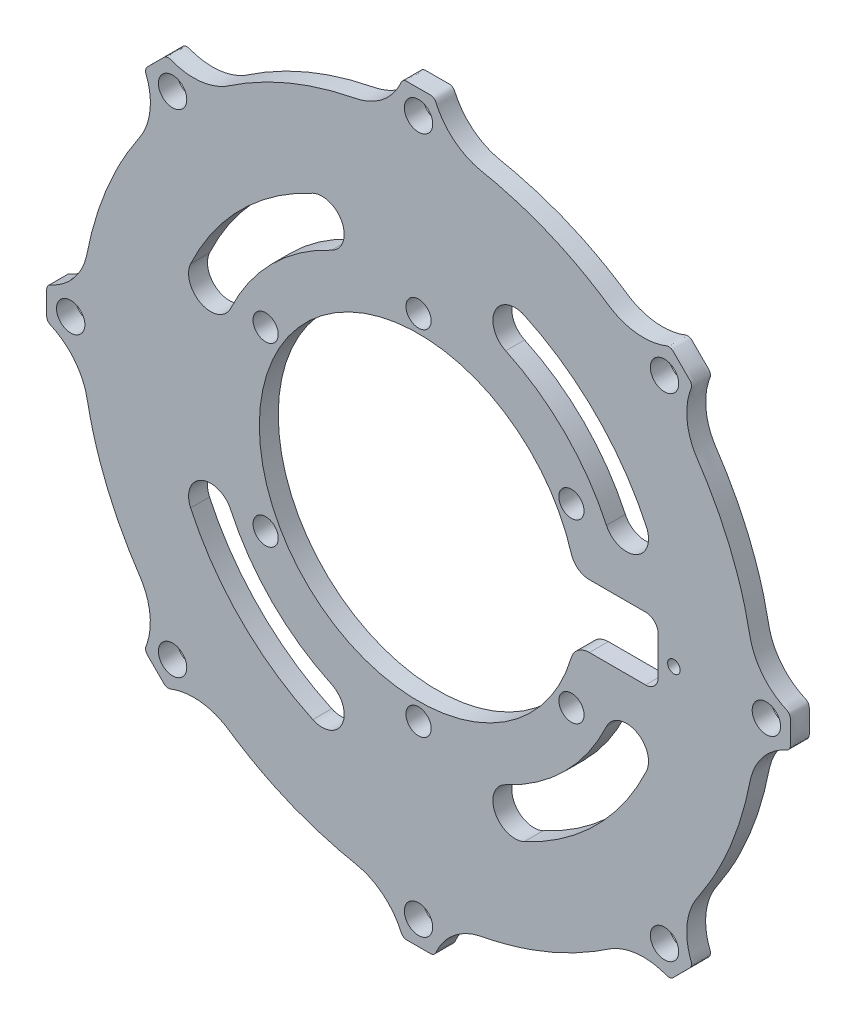
from build123d import *

# Parameters (mm, degrees)
SKETCH1_R                 = 1
BOSS_EXTRUDE1_DEPTH       = 3
F_4_0MM_DOWEL_HOLE1_D     = 4
F_4_0MM_DOWEL_HOLE1_DEPTH = 4
F_4_0MM_DOWEL_HOLE1_TIP   = 1.201721238
M4_CLEARANCE_HOLE1_D      = 4.5
M4_CLEARANCE_HOLE1_DEPTH  = 4
M4_CLEARANCE_HOLE1_TIP    = 1.351936393


with BuildPart() as part:
    # Sketch1 → Boss-Extrude1 (new body)
    with BuildSketch(Plane.XY):
        with BuildLine():
            add(Edge.make_bspline(
                [(-2.78417409, 58.319718749), (-2.791517372, 58.303124149), (-2.825354451, 58.225735415), (-2.86043616, 58.149718786), (-2.888569338, 58.090305414)],
                knots=[0.999328518, 0.999328518, 0.999328518, 0.999328518, 0.99947273, 1, 1, 1, 1], degree=3, weights=[1, 1, 1, 1, 1]))
            add(Edge.make_bspline(
                [(-2.888569338, 58.090305414), (-3.904277799, 55.9452699), (-5.591838924, 54.27644442), (-7.748079959, 53.284746062), (-8.235225684, 53.060698004), (-9.245557382, 52.690963884), (-10.84227328, 52.398071486), (-11.889156148, 52.164983222), (-12.410727624, 52.040597997), (-17.936005436, 50.722920633), (-23.183850069, 48.549192213), (-28.022550078, 45.573969403), (-28.479310442, 45.293116312), (-29.384386709, 44.717676629), (-30.720541549, 43.79573419), (-31.696395448, 43.342763299), (-32.199285394, 43.156725154), (-34.52028494, 42.298099023), (-36.994919588, 42.319571853), (-39.300669877, 43.218345087), (-39.301071956, 43.218501816), (-39.301876093, 43.218815326), (-39.303082259, 43.219285695), (-39.303886295, 43.219599465), (-39.304288312, 43.21975635), (-39.304689349, 43.219912852), (-39.305491422, 43.220225856), (-39.306694532, 43.220695362), (-39.307496605, 43.221008367), (-39.307897642, 43.221164869), (-39.310303861, 43.222103881), (-39.31271008, 43.223042894), (-39.3151163, 43.223981906), (-39.315517337, 43.224138408), (-39.31631941, 43.224451412), (-39.317522519, 43.224920919), (-39.318324593, 43.225233923), (-39.318725629, 43.225390425), (-39.319128068, 43.225547474), (-39.319932946, 43.225861573), (-39.321141382, 43.226329852), (-39.321947274, 43.226641342), (-39.32235032, 43.226796825), (-39.599832465, 43.333841276), (-39.896638588, 43.314841774), (-40.158207362, 43.173290965), (-40.186385644, 43.158041979), (-40.241276486, 43.124835529), (-40.32140827, 43.068886213), (-40.366719354, 43.023575129), (-40.389374896, 43.000919586), (-40.412030438, 42.978264044), (-40.457341522, 42.93295296), (-40.525308148, 42.864986334), (-40.570619233, 42.81967525), (-40.593274775, 42.797019708), (-41.327856419, 42.062438063), (-42.062438063, 41.327856419), (-42.797019708, 40.593274775), (-42.81967525, 40.570619233), (-42.864986334, 40.525308148), (-42.93295296, 40.457341522), (-42.978264044, 40.412030438), (-43.000919586, 40.389374896), (-43.023575129, 40.366719354), (-43.068886213, 40.32140827), (-43.124835529, 40.241276486), (-43.158041979, 40.186385644), (-43.173290965, 40.158207362), (-43.314841774, 39.896638588), (-43.333841276, 39.599832465), (-43.226796825, 39.32235032), (-43.226641342, 39.321947274), (-43.226329852, 39.321141382), (-43.225861573, 39.319932946), (-43.225547474, 39.319128068), (-43.225390425, 39.318725629), (-43.225233923, 39.318324593), (-43.224920919, 39.317522519), (-43.224451412, 39.31631941), (-43.224138408, 39.315517337), (-43.223981906, 39.3151163), (-43.223042894, 39.31271008), (-43.222103881, 39.310303861), (-43.221164869, 39.307897642), (-43.221008367, 39.307496605), (-43.220695362, 39.306694532), (-43.220225856, 39.305491422), (-43.219912852, 39.304689349), (-43.21975635, 39.304288312), (-43.219599465, 39.303886294), (-43.219285695, 39.303082259), (-43.218815326, 39.301876093), (-43.218501816, 39.301071956), (-43.218345087, 39.300669877), (-42.319571853, 36.994919588), (-42.298099023, 34.52028494), (-43.156725154, 32.199285394), (-43.342763299, 31.696395448), (-43.79573419, 30.720541549), (-44.717676629, 29.384386709), (-45.293116312, 28.479310442), (-45.573969403, 28.022550078), (-48.549192213, 23.183850069), (-50.722920633, 17.936005436), (-52.040597997, 12.410727624), (-52.164983222, 11.889156148), (-52.398071486, 10.84227328), (-52.690963884, 9.245557382), (-53.060698004, 8.235225684), (-53.284746062, 7.748079959), (-54.31880022, 5.499745081), (-56.083814744, 3.765097724), (-58.349755058, 2.770214708), (-58.350150195, 2.770041219), (-58.350940491, 2.769694293), (-58.35212598, 2.769174006), (-58.352916388, 2.768827336), (-58.353311592, 2.768654001), (-58.353705831, 2.768481089), (-58.35449431, 2.768135265), (-58.355677028, 2.767616529), (-58.356465507, 2.767270705), (-58.356859746, 2.767097793), (-58.359225182, 2.766060321), (-58.361590618, 2.765022849), (-58.363956055, 2.763985377), (-58.364350294, 2.763812465), (-58.365138773, 2.763466641), (-58.366321491, 2.762947905), (-58.367109969, 2.762602081), (-58.367504209, 2.762429169), (-58.367899827, 2.762255652), (-58.368691063, 2.761908619), (-58.36987668, 2.761385249), (-58.370666787, 2.761035654), (-58.371061728, 2.7608606), (-58.642963091, 2.640342951), (-58.839402036, 2.417034653), (-58.924267553, 2.131986062), (-58.933409946, 2.101278346), (-58.948743127, 2.038984153), (-58.965842714, 1.942760285), (-58.965842714, 1.878680735), (-58.965842714, 1.84664096), (-58.965842714, 1.814601185), (-58.965842714, 1.750521635), (-58.965842714, 1.654402311), (-58.965842714, 1.590322761), (-58.965842714, 1.558282986), (-58.965842714, 0.519427662), (-58.965842714, -0.519427662), (-58.965842714, -1.558282986), (-58.965842714, -1.590322761), (-58.965842714, -1.654402311), (-58.965842714, -1.750521635), (-58.965842714, -1.814601185), (-58.965842714, -1.84664096), (-58.965842714, -1.878680735), (-58.965842714, -1.942760285), (-58.948743127, -2.038984153), (-58.933409946, -2.101278346), (-58.924267553, -2.131986062), (-58.839402036, -2.417034653), (-58.642963091, -2.640342951), (-58.371061728, -2.7608606), (-58.370666787, -2.761035654), (-58.36987668, -2.761385249), (-58.368691063, -2.761908619), (-58.367899827, -2.762255652), (-58.367504209, -2.762429169), (-58.367109969, -2.762602081), (-58.366321491, -2.762947905), (-58.365138773, -2.763466641), (-58.364350294, -2.763812465), (-58.363956055, -2.763985377), (-58.361590618, -2.765022849), (-58.359225182, -2.766060321), (-58.356859746, -2.767097793), (-58.356465507, -2.767270705), (-58.355677028, -2.767616529), (-58.35449431, -2.768135265), (-58.353705831, -2.768481089), (-58.353311592, -2.768654001), (-58.352916388, -2.768827336), (-58.35212598, -2.769174006), (-58.350940491, -2.769694293), (-58.350150195, -2.770041219), (-58.349755058, -2.770214708), (-56.083814744, -3.765097724), (-54.31880022, -5.499745081), (-53.284746062, -7.748079959), (-53.060698004, -8.235225684), (-52.690963884, -9.245557382), (-52.398071486, -10.84227328), (-52.164983222, -11.889156148), (-52.040597997, -12.410727624), (-50.722920633, -17.936005436), (-48.549192213, -23.183850069), (-45.573969403, -28.022550078), (-45.293116312, -28.479310442), (-44.717676629, -29.384386709), (-43.79573419, -30.720541549), (-43.342763299, -31.696395448), (-43.156725154, -32.199285394), (-42.298099023, -34.52028494), (-42.319571853, -36.994919588), (-43.218345087, -39.300669877), (-43.218501816, -39.301071956), (-43.218815326, -39.301876093), (-43.219285695, -39.303082259), (-43.219599465, -39.303886294), (-43.21975635, -39.304288312), (-43.219912852, -39.304689349), (-43.220225856, -39.305491422), (-43.220695362, -39.306694532), (-43.221008367, -39.307496605), (-43.221164869, -39.307897642), (-43.222103881, -39.310303861), (-43.223042894, -39.31271008), (-43.223981906, -39.3151163), (-43.224138408, -39.315517337), (-43.224451412, -39.31631941), (-43.224920919, -39.317522519), (-43.225233923, -39.318324593), (-43.225390425, -39.318725629), (-43.225547474, -39.319128068), (-43.225861573, -39.319932946), (-43.226329852, -39.321141382), (-43.226641342, -39.321947274), (-43.226796825, -39.32235032), (-43.333841276, -39.599832465), (-43.314841774, -39.896638588), (-43.173290965, -40.158207362), (-43.158041979, -40.186385644), (-43.124835529, -40.241276486), (-43.068886213, -40.32140827), (-43.023575129, -40.366719354), (-43.000919586, -40.389374896), (-42.978264044, -40.412030438), (-42.93295296, -40.457341522), (-42.864986334, -40.525308148), (-42.81967525, -40.570619233), (-42.797019708, -40.593274775), (-42.062438063, -41.327856419), (-41.327856419, -42.062438063), (-40.593274775, -42.797019708), (-40.570619233, -42.81967525), (-40.525308148, -42.864986334), (-40.457341522, -42.93295296), (-40.412030438, -42.978264044), (-40.389374896, -43.000919586), (-40.366719354, -43.023575129), (-40.32140827, -43.068886213), (-40.241276486, -43.124835529), (-40.186385644, -43.158041979), (-40.158207362, -43.173290965), (-39.896638588, -43.314841774), (-39.599832465, -43.333841276), (-39.32235032, -43.226796825), (-39.321947274, -43.226641342), (-39.321141382, -43.226329852), (-39.319932946, -43.225861573), (-39.319128068, -43.225547474), (-39.318725629, -43.225390425), (-39.318324593, -43.225233923), (-39.317522519, -43.224920919), (-39.31631941, -43.224451412), (-39.315517337, -43.224138408), (-39.3151163, -43.223981906), (-39.31271008, -43.223042894), (-39.310303861, -43.222103881), (-39.307897642, -43.221164869), (-39.307496605, -43.221008367), (-39.306694532, -43.220695362), (-39.305491422, -43.220225856), (-39.304689349, -43.219912852), (-39.304288312, -43.21975635), (-39.303886294, -43.219599465), (-39.303082259, -43.219285695), (-39.301876093, -43.218815326), (-39.301071956, -43.218501816), (-39.300669877, -43.218345087), (-36.994919588, -42.319571853), (-34.52028494, -42.298099023), (-32.199285394, -43.156725154), (-31.696395448, -43.342763299), (-30.720541549, -43.79573419), (-29.384386709, -44.717676629), (-28.479310442, -45.293116312), (-28.022550078, -45.573969403), (-23.183850069, -48.549192213), (-17.936005436, -50.722920633), (-12.410727624, -52.040597997), (-11.889156148, -52.164983222), (-10.84227328, -52.398071486), (-9.245557382, -52.690963884), (-8.235225684, -53.060698004), (-7.748079959, -53.284746062), (-5.499745081, -54.31880022), (-3.765097724, -56.083814744), (-2.770214708, -58.349755058), (-2.770041219, -58.350150195), (-2.769694293, -58.350940491), (-2.769174006, -58.35212598), (-2.768827336, -58.352916388), (-2.768654001, -58.353311592), (-2.768481089, -58.353705831), (-2.768135265, -58.35449431), (-2.767616529, -58.355677028), (-2.767270705, -58.356465507), (-2.767097793, -58.356859746), (-2.766060321, -58.359225182), (-2.765022849, -58.361590618), (-2.763985377, -58.363956055), (-2.763812465, -58.364350294), (-2.763466641, -58.365138773), (-2.762947905, -58.366321491), (-2.762602081, -58.367109969), (-2.762429169, -58.367504209), (-2.762255652, -58.367899827), (-2.761908619, -58.368691063), (-2.761385249, -58.36987668), (-2.761035654, -58.370666787), (-2.7608606, -58.371061728), (-2.640342951, -58.642963091), (-2.417034653, -58.839402036), (-2.131986062, -58.924267553), (-2.101278346, -58.933409946), (-2.038984153, -58.948743127), (-1.942760285, -58.965842714), (-1.878680735, -58.965842714), (-1.84664096, -58.965842714), (-1.814601185, -58.965842714), (-1.750521635, -58.965842714), (-1.654402311, -58.965842714), (-1.590322761, -58.965842714), (-1.558282986, -58.965842714), (-0.519427662, -58.965842714), (0.519427662, -58.965842714), (1.558282986, -58.965842714), (1.590322761, -58.965842714), (1.654402311, -58.965842714), (1.750521635, -58.965842714), (1.814601185, -58.965842714), (1.84664096, -58.965842714), (1.878680735, -58.965842714), (1.942760285, -58.965842714), (2.038984153, -58.948743127), (2.101278346, -58.933409946), (2.131986062, -58.924267553), (2.417034653, -58.839402036), (2.640342951, -58.642963091), (2.7608606, -58.371061728), (2.761035654, -58.370666787), (2.761385249, -58.36987668), (2.761908619, -58.368691063), (2.762255652, -58.367899827), (2.762429169, -58.367504209), (2.762602081, -58.367109969), (2.762947905, -58.366321491), (2.763466641, -58.365138773), (2.763812465, -58.364350294), (2.763985377, -58.363956055), (2.765022849, -58.361590618), (2.766060321, -58.359225182), (2.767097793, -58.356859746), (2.767270705, -58.356465507), (2.767616529, -58.355677028), (2.768135265, -58.35449431), (2.768481089, -58.353705831), (2.768654001, -58.353311592), (2.768827336, -58.352916388), (2.769174006, -58.35212598), (2.769694293, -58.350940491), (2.770041219, -58.350150195), (2.770214708, -58.349755058), (3.765097724, -56.083814744), (5.499745081, -54.31880022), (7.748079959, -53.284746062), (8.235225684, -53.060698004), (9.245557382, -52.690963884), (10.84227328, -52.398071486), (11.889156148, -52.164983222), (12.410727624, -52.040597997), (17.936005436, -50.722920633), (23.183850069, -48.549192213), (28.022550078, -45.573969403), (28.479310442, -45.293116312), (29.384386709, -44.717676629), (30.720541549, -43.79573419), (31.696395448, -43.342763299), (32.199285394, -43.156725154), (34.52028494, -42.298099023), (36.994919588, -42.319571853), (39.300669877, -43.218345087), (39.301071956, -43.218501816), (39.301876093, -43.218815326), (39.303082259, -43.219285695), (39.303886294, -43.219599465), (39.304288312, -43.21975635), (39.304689349, -43.219912852), (39.305491422, -43.220225856), (39.306694532, -43.220695362), (39.307496605, -43.221008367), (39.307897642, -43.221164869), (39.310303861, -43.222103881), (39.31271008, -43.223042894), (39.3151163, -43.223981906), (39.315517337, -43.224138408), (39.31631941, -43.224451412), (39.317522519, -43.224920919), (39.318324593, -43.225233923), (39.318725629, -43.225390425), (39.319128068, -43.225547474), (39.319932946, -43.225861573), (39.321141382, -43.226329852), (39.321947274, -43.226641342), (39.32235032, -43.226796825), (39.599832465, -43.333841276), (39.896638588, -43.314841774), (40.158207362, -43.173290965), (40.186385644, -43.158041979), (40.241276486, -43.124835529), (40.32140827, -43.068886213), (40.366719354, -43.023575129), (40.389374896, -43.000919586), (40.412030438, -42.978264044), (40.457341522, -42.93295296), (40.525308148, -42.864986334), (40.570619233, -42.81967525), (40.593274775, -42.797019708), (41.327856419, -42.062438063), (42.062438063, -41.327856419), (42.797019708, -40.593274775), (42.81967525, -40.570619233), (42.864986334, -40.525308148), (42.93295296, -40.457341522), (42.978264044, -40.412030438), (43.000919586, -40.389374896), (43.023575129, -40.366719354), (43.068886213, -40.32140827), (43.124835529, -40.241276486), (43.158041979, -40.186385644), (43.173290965, -40.158207362), (43.314841774, -39.896638588), (43.333841276, -39.599832465), (43.226796825, -39.32235032), (43.226641342, -39.321947274), (43.226329852, -39.321141382), (43.225861573, -39.319932946), (43.225547474, -39.319128068), (43.225390425, -39.318725629), (43.225233923, -39.318324593), (43.224920919, -39.317522519), (43.224451412, -39.31631941), (43.224138408, -39.315517337), (43.223981906, -39.3151163), (43.223042894, -39.31271008), (43.222103881, -39.310303861), (43.221164869, -39.307897642), (43.221008367, -39.307496605), (43.220695362, -39.306694532), (43.220225856, -39.305491422), (43.219912852, -39.304689349), (43.21975635, -39.304288312), (43.219599465, -39.303886294), (43.219285695, -39.303082259), (43.218815326, -39.301876093), (43.218501816, -39.301071956), (43.218345087, -39.300669877), (42.319571853, -36.994919588), (42.298099023, -34.52028494), (43.156725154, -32.199285394), (43.342763299, -31.696395448), (43.79573419, -30.720541549), (44.717676629, -29.384386709), (45.293116312, -28.479310442), (45.573969403, -28.022550078), (48.549192213, -23.183850069), (50.722920633, -17.936005436), (52.040597997, -12.410727624), (52.164983222, -11.889156148), (52.398071486, -10.84227328), (52.690963884, -9.245557382), (53.060698004, -8.235225684), (53.284746062, -7.748079959), (54.31880022, -5.499745081), (56.083814744, -3.765097724), (58.349755058, -2.770214708), (58.350150195, -2.770041219), (58.350940491, -2.769694293), (58.35212598, -2.769174006), (58.352916388, -2.768827336), (58.353311592, -2.768654001), (58.353705831, -2.768481089), (58.35449431, -2.768135265), (58.355677028, -2.767616529), (58.356465507, -2.767270705), (58.356859746, -2.767097793), (58.359225182, -2.766060321), (58.361590618, -2.765022849), (58.363956055, -2.763985377), (58.364350294, -2.763812465), (58.365138773, -2.763466641), (58.366321491, -2.762947905), (58.367109969, -2.762602081), (58.367504209, -2.762429169), (58.367899827, -2.762255652), (58.368691063, -2.761908619), (58.36987668, -2.761385249), (58.370666787, -2.761035654), (58.371061728, -2.7608606), (58.642963091, -2.640342951), (58.839402036, -2.417034653), (58.924267553, -2.131986062), (58.933409946, -2.101278346), (58.948743127, -2.038984153), (58.965842714, -1.942760285), (58.965842714, -1.878680735), (58.965842714, -1.84664096), (58.965842714, -1.814601185), (58.965842714, -1.750521635), (58.965842714, -1.654402311), (58.965842714, -1.590322761), (58.965842714, -1.558282986), (58.965842714, -0.519427662), (58.965842714, 0.519427662), (58.965842714, 1.558282986), (58.965842714, 1.590322761), (58.965842714, 1.654402311), (58.965842714, 1.750521635), (58.965842714, 1.814601185), (58.965842714, 1.84664096), (58.965842714, 1.878680735), (58.965842714, 1.942760285), (58.948743127, 2.038984153), (58.933409946, 2.101278346), (58.924267553, 2.131986062), (58.839402036, 2.417034653), (58.642963091, 2.640342951), (58.371061728, 2.7608606), (58.370666787, 2.761035654), (58.36987668, 2.761385249), (58.368691063, 2.761908619), (58.367899827, 2.762255652), (58.367504209, 2.762429169), (58.367109969, 2.762602081), (58.366321491, 2.762947905), (58.365138773, 2.763466641), (58.364350294, 2.763812465), (58.363956055, 2.763985377), (58.361590618, 2.765022849), (58.359225182, 2.766060321), (58.356859746, 2.767097793), (58.356465507, 2.767270705), (58.355677028, 2.767616529), (58.35449431, 2.768135265), (58.353705831, 2.768481089), (58.353311592, 2.768654001), (58.352916388, 2.768827336), (58.35212598, 2.769174006), (58.350940491, 2.769694293), (58.350150195, 2.770041219), (58.349755058, 2.770214708), (56.083814744, 3.765097724), (54.31880022, 5.499745081), (53.284746062, 7.748079959), (53.060698004, 8.235225684), (52.690963884, 9.245557382), (52.398071486, 10.84227328), (52.164983222, 11.889156148), (52.040597997, 12.410727624), (50.722920633, 17.936005436), (48.549192213, 23.183850069), (45.573969403, 28.022550078), (45.293116312, 28.479310442), (44.717676629, 29.384386709), (43.79573419, 30.720541549), (43.342763299, 31.696395448), (43.156725154, 32.199285394), (42.298099023, 34.52028494), (42.319571853, 36.994919588), (43.218345087, 39.300669877), (43.218501816, 39.301071956), (43.218815326, 39.301876093), (43.219285695, 39.303082259), (43.219599465, 39.303886294), (43.21975635, 39.304288312), (43.219912852, 39.304689349), (43.220225856, 39.305491422), (43.220695362, 39.306694532), (43.221008367, 39.307496605), (43.221164869, 39.307897642), (43.222103881, 39.310303861), (43.223042894, 39.31271008), (43.223981906, 39.3151163), (43.224138408, 39.315517337), (43.224451412, 39.31631941), (43.224920919, 39.317522519), (43.225233923, 39.318324593), (43.225390425, 39.318725629), (43.225547474, 39.319128068), (43.225861573, 39.319932946), (43.226329852, 39.321141382), (43.226641342, 39.321947274), (43.226796825, 39.32235032), (43.333841276, 39.599832465), (43.314841774, 39.896638588), (43.173290965, 40.158207362), (43.158041979, 40.186385644), (43.124835529, 40.241276486), (43.068886213, 40.32140827), (43.023575129, 40.366719354), (43.000919586, 40.389374896), (42.978264044, 40.412030438), (42.93295296, 40.457341522), (42.864986334, 40.525308148), (42.81967525, 40.570619233), (42.797019708, 40.593274775), (42.062438063, 41.327856419), (41.327856419, 42.062438063), (40.593274775, 42.797019708), (40.570619233, 42.81967525), (40.525308148, 42.864986334), (40.457341522, 42.93295296), (40.412030438, 42.978264044), (40.389374896, 43.000919586), (40.366719354, 43.023575129), (40.32140827, 43.068886213), (40.241276486, 43.124835529), (40.186385644, 43.158041979), (40.158207362, 43.173290965), (39.896638588, 43.314841774), (39.599832465, 43.333841276), (39.32235032, 43.226796825), (39.321947274, 43.226641342), (39.321141382, 43.226329852), (39.319932946, 43.225861573), (39.319128068, 43.225547474), (39.318725629, 43.225390425), (39.318324593, 43.225233923), (39.317522519, 43.224920919), (39.31631941, 43.224451412), (39.315517337, 43.224138408), (39.3151163, 43.223981906), (39.31271008, 43.223042894), (39.310303861, 43.222103881), (39.307897642, 43.221164869), (39.307496605, 43.221008367), (39.306694532, 43.220695362), (39.305491422, 43.220225856), (39.304689349, 43.219912852), (39.304288312, 43.21975635), (39.303886294, 43.219599465), (39.303082259, 43.219285695), (39.301876093, 43.218815326), (39.301071956, 43.218501816), (39.300669877, 43.218345087), (36.994919588, 42.319571853), (34.52028494, 42.298099023), (32.199285394, 43.156725154), (31.696395448, 43.342763299), (30.720541549, 43.79573419), (29.384386709, 44.717676629), (28.479310442, 45.293116312), (28.022550078, 45.573969403), (23.183850069, 48.549192213), (17.936005436, 50.722920633), (12.410727624, 52.040597997), (11.889156148, 52.164983222), (10.84227328, 52.398071486), (9.245557382, 52.690963884), (8.235225684, 53.060698004), (7.748079959, 53.284746062), (5.591838924, 54.27644442), (3.904277799, 55.9452699), (2.888569338, 58.090305414), (2.86043616, 58.149718786), (2.805341513, 58.269100351), (2.727304111, 58.453248868), (2.652227716, 58.561956296), (2.609742987, 58.612120747), (2.483296792, 58.761423899), (2.319504695, 58.868438946), (2.131986062, 58.924267553), (2.101278346, 58.933409946), (2.038984153, 58.948743127), (1.942760285, 58.965842714), (1.878680735, 58.965842714), (1.84664096, 58.965842714), (1.814601185, 58.965842714), (1.750521635, 58.965842714), (1.654402311, 58.965842714), (1.590322761, 58.965842714), (1.558282986, 58.965842714), (0.519427662, 58.965842714), (-0.519427662, 58.965842714), (-1.558282986, 58.965842714), (-1.590322761, 58.965842714), (-1.654402311, 58.965842714), (-1.750521635, 58.965842714), (-1.814601185, 58.965842714), (-1.84664096, 58.965842714), (-1.878680735, 58.965842714), (-1.942760285, 58.965842714), (-2.038984153, 58.948743127), (-2.101278346, 58.933409946), (-2.131986062, 58.924267553), (-2.319504695, 58.868438946), (-2.483296792, 58.761423899), (-2.609742987, 58.612120747), (-2.652227716, 58.561956296), (-2.717037152, 58.468114989), (-2.764668765, 58.363797551), (-2.78417409, 58.319718749)],
                knots=[0, 0, 0, 0, 0.018272392, 0.018272392, 0.018272392, 0.022573152, 0.026873912, 0.031174673, 0.031174673, 0.031174673, 0.076353702, 0.076353702, 0.076353702, 0.080654462, 0.084955222, 0.089255982, 0.089255982, 0.089255982, 0.108243055, 0.108243055, 0.108243055, 0.108246516, 0.108249978, 0.108253439, 0.108253439, 0.108253439, 0.108256892, 0.108260345, 0.108263798, 0.108263798, 0.108263798, 0.108284515, 0.108284515, 0.108284515, 0.108287968, 0.108291421, 0.108294874, 0.108294874, 0.108294874, 0.108298339, 0.108301804, 0.108305269, 0.108305269, 0.108305269, 0.110544601, 0.110544601, 0.110544601, 0.110801587, 0.111058573, 0.111315559, 0.111315559, 0.111315559, 0.111572545, 0.111829531, 0.112086517, 0.112086517, 0.112086517, 0.12041901, 0.12041901, 0.12041901, 0.120675996, 0.120932982, 0.121189968, 0.121189968, 0.121189968, 0.121446954, 0.12170394, 0.121960926, 0.121960926, 0.121960926, 0.124200258, 0.124200258, 0.124200258, 0.124203723, 0.124207188, 0.124210653, 0.124210653, 0.124210653, 0.124214106, 0.124217559, 0.124221012, 0.124221012, 0.124221012, 0.124241729, 0.124241729, 0.124241729, 0.124245182, 0.124248635, 0.124252088, 0.124252088, 0.124252088, 0.12425555, 0.124259011, 0.124262472, 0.124262472, 0.124262472, 0.143249545, 0.143249545, 0.143249545, 0.147550305, 0.151851065, 0.156151825, 0.156151825, 0.156151825, 0.201330854, 0.201330854, 0.201330854, 0.205631615, 0.209932375, 0.214233135, 0.214233135, 0.214233135, 0.233220208, 0.233220208, 0.233220208, 0.233223669, 0.23322713, 0.233230592, 0.233230592, 0.233230592, 0.233234045, 0.233237497, 0.23324095, 0.23324095, 0.23324095, 0.233261668, 0.233261668, 0.233261668, 0.233265121, 0.233268574, 0.233272027, 0.233272027, 0.233272027, 0.233275492, 0.233278957, 0.233282421, 0.233282421, 0.233282421, 0.235521754, 0.235521754, 0.235521754, 0.23577874, 0.236035726, 0.236292712, 0.236292712, 0.236292712, 0.236549698, 0.236806684, 0.23706367, 0.23706367, 0.23706367, 0.245396163, 0.245396163, 0.245396163, 0.245653149, 0.245910135, 0.246167121, 0.246167121, 0.246167121, 0.246424107, 0.246681092, 0.246938078, 0.246938078, 0.246938078, 0.249177411, 0.249177411, 0.249177411, 0.249180876, 0.249184341, 0.249187806, 0.249187806, 0.249187806, 0.249191259, 0.249194712, 0.249198165, 0.249198165, 0.249198165, 0.249218882, 0.249218882, 0.249218882, 0.249222335, 0.249225788, 0.249229241, 0.249229241, 0.249229241, 0.249232702, 0.249236164, 0.249239625, 0.249239625, 0.249239625, 0.268226698, 0.268226698, 0.268226698, 0.272527458, 0.276828218, 0.281128978, 0.281128978, 0.281128978, 0.326308007, 0.326308007, 0.326308007, 0.330608767, 0.334909528, 0.339210288, 0.339210288, 0.339210288, 0.35819736, 0.35819736, 0.35819736, 0.358200822, 0.358204283, 0.358207744, 0.358207744, 0.358207744, 0.358211197, 0.35821465, 0.358218103, 0.358218103, 0.358218103, 0.358238821, 0.358238821, 0.358238821, 0.358242273, 0.358245726, 0.358249179, 0.358249179, 0.358249179, 0.358252644, 0.358256109, 0.358259574, 0.358259574, 0.358259574, 0.360498907, 0.360498907, 0.360498907, 0.360755893, 0.361012879, 0.361269865, 0.361269865, 0.361269865, 0.361526851, 0.361783837, 0.362040823, 0.362040823, 0.362040823, 0.370373316, 0.370373316, 0.370373316, 0.370630301, 0.370887287, 0.371144273, 0.371144273, 0.371144273, 0.371401259, 0.371658245, 0.371915231, 0.371915231, 0.371915231, 0.374154564, 0.374154564, 0.374154564, 0.374158029, 0.374161494, 0.374164959, 0.374164959, 0.374164959, 0.374168412, 0.374171865, 0.374175318, 0.374175318, 0.374175318, 0.374196035, 0.374196035, 0.374196035, 0.374199488, 0.374202941, 0.374206394, 0.374206394, 0.374206394, 0.374209855, 0.374213316, 0.374216778, 0.374216778, 0.374216778, 0.39320385, 0.39320385, 0.39320385, 0.397504611, 0.401805371, 0.406106131, 0.406106131, 0.406106131, 0.45128516, 0.45128516, 0.45128516, 0.45558592, 0.45988668, 0.46418744, 0.46418744, 0.46418744, 0.483174513, 0.483174513, 0.483174513, 0.483177974, 0.483181436, 0.483184897, 0.483184897, 0.483184897, 0.48318835, 0.483191803, 0.483195256, 0.483195256, 0.483195256, 0.483215973, 0.483215973, 0.483215973, 0.483219426, 0.483222879, 0.483226332, 0.483226332, 0.483226332, 0.483229797, 0.483233262, 0.483236727, 0.483236727, 0.483236727, 0.48547606, 0.48547606, 0.48547606, 0.485733046, 0.485990032, 0.486247017, 0.486247017, 0.486247017, 0.486504003, 0.486760989, 0.487017975, 0.487017975, 0.487017975, 0.495350468, 0.495350468, 0.495350468, 0.495607454, 0.49586444, 0.496121426, 0.496121426, 0.496121426, 0.496378412, 0.496635398, 0.496892384, 0.496892384, 0.496892384, 0.499131717, 0.499131717, 0.499131717, 0.499135182, 0.499138647, 0.499142112, 0.499142112, 0.499142112, 0.499145564, 0.499149017, 0.49915247, 0.49915247, 0.49915247, 0.499173188, 0.499173188, 0.499173188, 0.499176641, 0.499180094, 0.499183546, 0.499183546, 0.499183546, 0.499187008, 0.499190469, 0.49919393, 0.49919393, 0.49919393, 0.518181003, 0.518181003, 0.518181003, 0.522481763, 0.526782523, 0.531083284, 0.531083284, 0.531083284, 0.576262313, 0.576262313, 0.576262313, 0.580563073, 0.584863833, 0.589164593, 0.589164593, 0.589164593, 0.608151666, 0.608151666, 0.608151666, 0.608155127, 0.608158589, 0.60816205, 0.60816205, 0.60816205, 0.608165503, 0.608168956, 0.608172409, 0.608172409, 0.608172409, 0.608193126, 0.608193126, 0.608193126, 0.608196579, 0.608200032, 0.608203485, 0.608203485, 0.608203485, 0.60820695, 0.608210415, 0.60821388, 0.60821388, 0.60821388, 0.610453212, 0.610453212, 0.610453212, 0.610710198, 0.610967184, 0.61122417, 0.61122417, 0.61122417, 0.611481156, 0.611738142, 0.611995128, 0.611995128, 0.611995128, 0.620327621, 0.620327621, 0.620327621, 0.620584607, 0.620841593, 0.621098579, 0.621098579, 0.621098579, 0.621355565, 0.621612551, 0.621869537, 0.621869537, 0.621869537, 0.624108869, 0.624108869, 0.624108869, 0.624112334, 0.624115799, 0.624119264, 0.624119264, 0.624119264, 0.624122717, 0.62412617, 0.624129623, 0.624129623, 0.624129623, 0.62415034, 0.62415034, 0.62415034, 0.624153793, 0.624157246, 0.624160699, 0.624160699, 0.624160699, 0.624164161, 0.624167622, 0.624171083, 0.624171083, 0.624171083, 0.643158156, 0.643158156, 0.643158156, 0.647458916, 0.651759676, 0.656060436, 0.656060436, 0.656060436, 0.701239465, 0.701239465, 0.701239465, 0.705540226, 0.709840986, 0.714141746, 0.714141746, 0.714141746, 0.733128819, 0.733128819, 0.733128819, 0.73313228, 0.733135741, 0.733139203, 0.733139203, 0.733139203, 0.733142656, 0.733146108, 0.733149561, 0.733149561, 0.733149561, 0.733170279, 0.733170279, 0.733170279, 0.733173732, 0.733177185, 0.733180638, 0.733180638, 0.733180638, 0.733184103, 0.733187567, 0.733191032, 0.733191032, 0.733191032, 0.735430365, 0.735430365, 0.735430365, 0.735687351, 0.735944337, 0.736201323, 0.736201323, 0.736201323, 0.736458309, 0.736715295, 0.736972281, 0.736972281, 0.736972281, 0.745304774, 0.745304774, 0.745304774, 0.74556176, 0.745818746, 0.746075732, 0.746075732, 0.746075732, 0.746332718, 0.746589703, 0.746846689, 0.746846689, 0.746846689, 0.749086022, 0.749086022, 0.749086022, 0.749089487, 0.749092952, 0.749096417, 0.749096417, 0.749096417, 0.74909987, 0.749103323, 0.749106776, 0.749106776, 0.749106776, 0.749127493, 0.749127493, 0.749127493, 0.749130946, 0.749134399, 0.749137852, 0.749137852, 0.749137852, 0.749141313, 0.749144775, 0.749148236, 0.749148236, 0.749148236, 0.768135309, 0.768135309, 0.768135309, 0.772436069, 0.776736829, 0.781037589, 0.781037589, 0.781037589, 0.826216618, 0.826216618, 0.826216618, 0.830517378, 0.834818139, 0.839118899, 0.839118899, 0.839118899, 0.858105971, 0.858105971, 0.858105971, 0.858109433, 0.858112894, 0.858116355, 0.858116355, 0.858116355, 0.858119808, 0.858123261, 0.858126714, 0.858126714, 0.858126714, 0.858147432, 0.858147432, 0.858147432, 0.858150884, 0.858154337, 0.85815779, 0.85815779, 0.85815779, 0.858161255, 0.85816472, 0.858168185, 0.858168185, 0.858168185, 0.860407518, 0.860407518, 0.860407518, 0.860664504, 0.86092149, 0.861178476, 0.861178476, 0.861178476, 0.861435462, 0.861692448, 0.861949434, 0.861949434, 0.861949434, 0.870281927, 0.870281927, 0.870281927, 0.870538912, 0.870795898, 0.871052884, 0.871052884, 0.871052884, 0.87130987, 0.871566856, 0.871823842, 0.871823842, 0.871823842, 0.874063175, 0.874063175, 0.874063175, 0.87406664, 0.874070105, 0.87407357, 0.87407357, 0.87407357, 0.874077023, 0.874080476, 0.874083928, 0.874083928, 0.874083928, 0.874104646, 0.874104646, 0.874104646, 0.874108099, 0.874111552, 0.874115005, 0.874115005, 0.874115005, 0.874118466, 0.874121927, 0.874125389, 0.874125389, 0.874125389, 0.893112461, 0.893112461, 0.893112461, 0.897413222, 0.901713982, 0.906014742, 0.906014742, 0.906014742, 0.951193771, 0.951193771, 0.951193771, 0.955494531, 0.959795291, 0.964096051, 0.964096051, 0.964096051, 0.982368444, 0.982368444, 0.982368444, 0.982895714, 0.983422984, 0.983950255, 0.983950255, 0.983950255, 0.98547606, 0.98547606, 0.98547606, 0.985733046, 0.985990032, 0.986247017, 0.986247017, 0.986247017, 0.986504003, 0.986760989, 0.987017975, 0.987017975, 0.987017975, 0.995350468, 0.995350468, 0.995350468, 0.995607454, 0.99586444, 0.996121426, 0.996121426, 0.996121426, 0.996378412, 0.996635398, 0.996892384, 0.996892384, 0.996892384, 0.998418189, 0.998418189, 0.998418189, 0.998945459, 0.999328518, 0.999328518, 0.999328518, 0.999328518], degree=3, weights=[1, 0.959868564, 0.959868564, 1, 1, 1, 1, 1, 1, 0.991633934, 0.991633934, 1, 1, 1, 1, 1, 1, 0.956556623, 0.956556623, 1, 1, 1, 1, 1, 1, 1, 1, 1, 1, 1, 1, 1, 1, 1, 1, 1, 1, 1, 1, 1, 1, 1, 1, 0.938723945, 0.938723945, 1, 1, 1, 1, 1, 1, 1, 1, 1, 1, 1, 1, 1, 1, 1, 1, 1, 1, 1, 1, 1, 1, 1, 1, 0.938723945, 0.938723945, 1, 1, 1, 1, 1, 1, 1, 1, 1, 1, 1, 1, 1, 1, 1, 1, 1, 1, 1, 1, 1, 1, 1, 1, 0.956556623, 0.956556623, 1, 1, 1, 1, 1, 1, 0.991633934, 0.991633934, 1, 1, 1, 1, 1, 1, 0.956556623, 0.956556623, 1, 1, 1, 1, 1, 1, 1, 1, 1, 1, 1, 1, 1, 1, 1, 1, 1, 1, 1, 1, 1, 1, 1, 1, 0.938723945, 0.938723945, 1, 1, 1, 1, 1, 1, 1, 1, 1, 1, 1, 1, 1, 1, 1, 1, 1, 1, 1, 1, 1, 1, 1, 1, 0.938723945, 0.938723945, 1, 1, 1, 1, 1, 1, 1, 1, 1, 1, 1, 1, 1, 1, 1, 1, 1, 1, 1, 1, 1, 1, 1, 1, 0.956556623, 0.956556623, 1, 1, 1, 1, 1, 1, 0.991633934, 0.991633934, 1, 1, 1, 1, 1, 1, 0.956556623, 0.956556623, 1, 1, 1, 1, 1, 1, 1, 1, 1, 1, 1, 1, 1, 1, 1, 1, 1, 1, 1, 1, 1, 1, 1, 1, 0.938723945, 0.938723945, 1, 1, 1, 1, 1, 1, 1, 1, 1, 1, 1, 1, 1, 1, 1, 1, 1, 1, 1, 1, 1, 1, 1, 1, 0.938723945, 0.938723945, 1, 1, 1, 1, 1, 1, 1, 1, 1, 1, 1, 1, 1, 1, 1, 1, 1, 1, 1, 1, 1, 1, 1, 1, 0.956556623, 0.956556623, 1, 1, 1, 1, 1, 1, 0.991633934, 0.991633934, 1, 1, 1, 1, 1, 1, 0.956556623, 0.956556623, 1, 1, 1, 1, 1, 1, 1, 1, 1, 1, 1, 1, 1, 1, 1, 1, 1, 1, 1, 1, 1, 1, 1, 1, 0.938723945, 0.938723945, 1, 1, 1, 1, 1, 1, 1, 1, 1, 1, 1, 1, 1, 1, 1, 1, 1, 1, 1, 1, 1, 1, 1, 1, 0.938723945, 0.938723945, 1, 1, 1, 1, 1, 1, 1, 1, 1, 1, 1, 1, 1, 1, 1, 1, 1, 1, 1, 1, 1, 1, 1, 1, 0.956556623, 0.956556623, 1, 1, 1, 1, 1, 1, 0.991633934, 0.991633934, 1, 1, 1, 1, 1, 1, 0.956556623, 0.956556623, 1, 1, 1, 1, 1, 1, 1, 1, 1, 1, 1, 1, 1, 1, 1, 1, 1, 1, 1, 1, 1, 1, 1, 1, 0.938723945, 0.938723945, 1, 1, 1, 1, 1, 1, 1, 1, 1, 1, 1, 1, 1, 1, 1, 1, 1, 1, 1, 1, 1, 1, 1, 1, 0.938723945, 0.938723945, 1, 1, 1, 1, 1, 1, 1, 1, 1, 1, 1, 1, 1, 1, 1, 1, 1, 1, 1, 1, 1, 1, 1, 1, 0.956556623, 0.956556623, 1, 1, 1, 1, 1, 1, 0.991633934, 0.991633934, 1, 1, 1, 1, 1, 1, 0.956556623, 0.956556623, 1, 1, 1, 1, 1, 1, 1, 1, 1, 1, 1, 1, 1, 1, 1, 1, 1, 1, 1, 1, 1, 1, 1, 1, 0.938723945, 0.938723945, 1, 1, 1, 1, 1, 1, 1, 1, 1, 1, 1, 1, 1, 1, 1, 1, 1, 1, 1, 1, 1, 1, 1, 1, 0.938723945, 0.938723945, 1, 1, 1, 1, 1, 1, 1, 1, 1, 1, 1, 1, 1, 1, 1, 1, 1, 1, 1, 1, 1, 1, 1, 1, 0.956556623, 0.956556623, 1, 1, 1, 1, 1, 1, 0.991633934, 0.991633934, 1, 1, 1, 1, 1, 1, 0.956556623, 0.956556623, 1, 1, 1, 1, 1, 1, 1, 1, 1, 1, 1, 1, 1, 1, 1, 1, 1, 1, 1, 1, 1, 1, 1, 1, 0.938723945, 0.938723945, 1, 1, 1, 1, 1, 1, 1, 1, 1, 1, 1, 1, 1, 1, 1, 1, 1, 1, 1, 1, 1, 1, 1, 1, 0.938723945, 0.938723945, 1, 1, 1, 1, 1, 1, 1, 1, 1, 1, 1, 1, 1, 1, 1, 1, 1, 1, 1, 1, 1, 1, 1, 1, 0.956556623, 0.956556623, 1, 1, 1, 1, 1, 1, 0.991633934, 0.991633934, 1, 1, 1, 1, 1, 1, 0.959868564, 0.959868564, 1, 1, 1, 1, 1, 1, 0.972283226, 0.972283226, 1, 1, 1, 1, 1, 1, 1, 1, 1, 1, 1, 1, 1, 1, 1, 1, 1, 1, 1, 1, 1, 1, 1, 1, 0.972283226, 0.972283226, 1, 1, 1, 1, 1]))
        make_face()
        with BuildLine():
            ThreePointArc((-16.766354404, -36.146345677), (-28.175068286, -28.175068286), (-36.146345677, -16.766354404))
            ThreePointArc((-36.146345677, -16.766354404), (-34.444023934, -12.118548397), (-29.796217927, -13.82087014))
            ThreePointArc((-29.796217927, -13.82087014), (-23.225320818, -23.225320818), (-13.82087014, -29.796217927))
            ThreePointArc((-13.82087014, -29.796217927), (-12.118548397, -34.444023934), (-16.766354404, -36.146345677))
        make_face(mode=Mode.SUBTRACT)
        with BuildLine():
            ThreePointArc((36.146345677, -16.766354404), (28.175068286, -28.175068286), (16.766354404, -36.146345677))
            ThreePointArc((16.766354404, -36.146345677), (12.118548397, -34.444023934), (13.82087014, -29.796217927))
            ThreePointArc((13.82087014, -29.796217927), (23.225320818, -23.225320818), (29.796217927, -13.82087014))
            ThreePointArc((29.796217927, -13.82087014), (34.444023934, -12.118548397), (36.146345677, -16.766354404))
        make_face(mode=Mode.SUBTRACT)
        with Locations((40.499304298, -0.237384428)):
            Circle(SKETCH1_R, mode=Mode.SUBTRACT)
        with BuildLine():
            ThreePointArc((-36.146345677, 16.766354404), (-28.175068286, 28.175068286), (-16.766354404, 36.146345677))
            ThreePointArc((-16.766354404, 36.146345677), (-12.118548397, 34.444023934), (-13.82087014, 29.796217927))
            ThreePointArc((-13.82087014, 29.796217927), (-23.225320818, 23.225320818), (-29.796217927, 13.82087014))
            ThreePointArc((-29.796217927, 13.82087014), (-34.444023934, 12.118548397), (-36.146345677, 16.766354404))
        make_face(mode=Mode.SUBTRACT)
        with BuildLine():
            Line((38, 3), (38, -3))
            ThreePointArc((38, -3), (37.414213562, -4.414213562), (36, -5))
            Line((36, -5), (27.093587802, -5))
            ThreePointArc((27.093587802, -5), (25.297574518, -5.59701513), (24.216392637, -7.150442478))
            ThreePointArc((24.216392637, -7.150442478), (-25.25, 0), (24.216392637, 7.150442478))
            ThreePointArc((24.216392637, 7.150442478), (25.297574518, 5.59701513), (27.093587802, 5))
            Line((27.093587802, 5), (36, 5))
            ThreePointArc((36, 5), (37.414213562, 4.414213562), (38, 3))
        make_face(mode=Mode.SUBTRACT)
        with BuildLine():
            ThreePointArc((16.766354404, 36.146345677), (28.175068286, 28.175068286), (36.146345677, 16.766354404))
            ThreePointArc((36.146345677, 16.766354404), (34.444023934, 12.118548397), (29.796217927, 13.82087014))
            ThreePointArc((29.796217927, 13.82087014), (23.225320818, 23.225320818), (13.82087014, 29.796217927))
            ThreePointArc((13.82087014, 29.796217927), (12.118548397, 34.444023934), (16.766354404, 36.146345677))
        make_face(mode=Mode.SUBTRACT)
    extrude(amount=BOSS_EXTRUDE1_DEPTH)

    # Ø4.0mm Dowel Hole1
    with Locations(Plane.XY.offset(3)):
        with Locations((0, 28), (24.248711306, 14), (24.248711306, -14), (0, -28), (-24.248711306, -14), (-24.248711306, 14)):
            Hole(F_4_0MM_DOWEL_HOLE1_D / 2, depth=F_4_0MM_DOWEL_HOLE1_DEPTH)
            with Locations((0, 0, -(F_4_0MM_DOWEL_HOLE1_DEPTH + F_4_0MM_DOWEL_HOLE1_TIP / 2))):  # 118° drill point
                Cone(0, F_4_0MM_DOWEL_HOLE1_D / 2, F_4_0MM_DOWEL_HOLE1_TIP, mode=Mode.SUBTRACT)

    # M4 Clearance Hole1
    with Locations(Plane.XY.offset(3)):
        with Locations((0, 55.165842714), (-39.008141473, 39.008141473), (39.008141473, 39.008141473), (55.165842714, 0), (39.008141473, -39.008141473), (-55.165842714, 0), (-39.008141473, -39.008141473), (0, -55.165842714)):
            Hole(M4_CLEARANCE_HOLE1_D / 2, depth=M4_CLEARANCE_HOLE1_DEPTH)
            with Locations((0, 0, -(M4_CLEARANCE_HOLE1_DEPTH + M4_CLEARANCE_HOLE1_TIP / 2))):  # 118° drill point
                Cone(0, M4_CLEARANCE_HOLE1_D / 2, M4_CLEARANCE_HOLE1_TIP, mode=Mode.SUBTRACT)


solid = part.part
